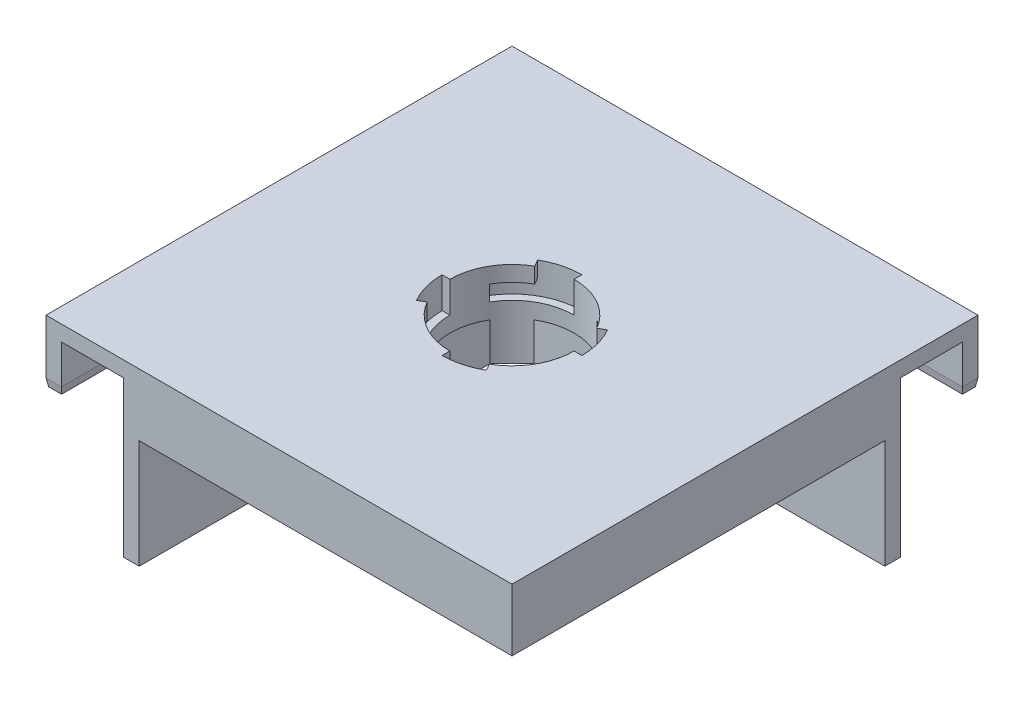
from build123d import *
from OCP.BRepFilletAPI import BRepFilletAPI_MakeChamfer
from build123d.topology import SkipClean

# Parameters (mm, degrees)
SKETCH1_R                 = 12
SKETCH1_R_2               = 8
BOSS_EXTRUDE4_DEPTH       = 2
BOSS_EXTRUDE5_START       = 2
SKETCH1_9_R               = 12
SKETCH1_9_R_2             = 9
BOSS_EXTRUDE5_DEPTH       = 4
BOSS_EXTRUDE6_START       = 2
BOSS_EXTRUDE6_DEPTH       = 2
BOSS_EXTRUDE7_START       = 4
BOSS_EXTRUDE7_DEPTH       = 2
BOSS_EXTRUDE8_START       = 4
SKETCH1_12_W              = 60
SKETCH1_12_H              = 60
SKETCH1_12_R              = 12
BOSS_EXTRUDE8_DEPTH       = 2
BOSS_EXTRUDE9_DEPTH       = 6
CHAMFER1_SIZE             = 1
CHAMFER1_SIZE2            = 0.176326981
BOSS_EXTRUDE10_DEPTH      = 6
BOSS_EXTRUDE11_DEPTH      = 20
BOSS_EXTRUDE12_DEPTH      = 2
BOSS_EXTRUDE12_DEPTH_BACK = 2
SKETCH1_14_R              = 8
CUT_EXTRUDE1_DEPTH        = 46.343136195


with BuildPart() as part:
    # Sketch1 → Boss-Extrude4 (new body)
    with BuildSketch(Plane(origin=(0, 0, 0), x_dir=(1, 0, 0), z_dir=(0, 1, 0))):
        with Locations(Location((0, 0, 0), (0, 0, 270))):
            Circle(SKETCH1_R)
        with Locations(Location((0, 0, 0), (0, 0, 270))):
            Circle(SKETCH1_R_2, mode=Mode.SUBTRACT)
    extrude(amount=BOSS_EXTRUDE4_DEPTH)

    # Sketch1<9> → Boss-Extrude5 (add)
    with BuildSketch(Plane(origin=(0, 0, 0), x_dir=(1, 0, 0), z_dir=(0, 1, 0)).offset(BOSS_EXTRUDE5_START)):
        with Locations(Location((0, 0, 0), (0, 0, 270))):
            Circle(SKETCH1_9_R)
        with Locations(Location((0, 0, 0), (0, 0, 270))):
            Circle(SKETCH1_9_R_2, mode=Mode.SUBTRACT)
    extrude(amount=BOSS_EXTRUDE5_DEPTH)

    # Sketch1<10> → Boss-Extrude6 (add)
    with SkipClean():  # the faces are left unmerged after this step: merging them gives an invalid solid
        with BuildSketch(Plane(origin=(0, 0, 0), x_dir=(1, 0, 0), z_dir=(0, 1, 0)).offset(BOSS_EXTRUDE6_START)):
            with BuildLine():
                ThreePointArc((0, 8), (2.070552361, 7.72740661), (4, 6.92820323))
                Line((4, 6.92820323), (4.5, 7.794228634))
                ThreePointArc((4.5, 7.794228634), (2.329371406, 8.693332437), (0, 9))
                Line((0, 9), (0, 8))
            make_face()
            with BuildLine():
                ThreePointArc((-8, 0), (-7.72740661, 2.070552361), (-6.92820323, 4))
                Line((-6.92820323, 4), (-7.794228634, 4.5))
                ThreePointArc((-7.794228634, 4.5), (-8.693332437, 2.329371406), (-9, 0))
                Line((-9, 0), (-8, 0))
            make_face()
            with BuildLine():
                Line((0, -9), (0, -8))
                ThreePointArc((0, -8), (-2.070552361, -7.72740661), (-4, -6.92820323))
                Line((-4, -6.92820323), (-4.5, -7.794228634))
                ThreePointArc((-4.5, -7.794228634), (-2.329371406, -8.693332437), (0, -9))
            make_face()
            with BuildLine():
                Line((9, 0), (8, 0))
                ThreePointArc((8, 0), (7.72740661, -2.070552361), (6.92820323, -4))
                Line((6.92820323, -4), (7.794228634, -4.5))
                ThreePointArc((7.794228634, -4.5), (8.693332437, -2.329371406), (9, 0))
            make_face()
        extrude(amount=BOSS_EXTRUDE6_DEPTH)

    # Sketch1<11> → Boss-Extrude7 (add)
    with SkipClean():  # the faces are left unmerged after this step: merging them gives an invalid solid
        with BuildSketch(Plane(origin=(0, 0, 0), x_dir=(1, 0, 0), z_dir=(0, 1, 0)).offset(BOSS_EXTRUDE7_START)):
            with BuildLine():
                ThreePointArc((0, 8), (2.070552361, 7.72740661), (4, 6.92820323))
                Line((4, 6.92820323), (4.5, 7.794228634))
                ThreePointArc((4.5, 7.794228634), (2.329371406, 8.693332437), (0, 9))
                Line((0, 9), (0, 8))
            make_face()
            with BuildLine():
                ThreePointArc((4, 6.92820323), (5.656854249, 5.656854249), (6.92820323, 4))
                Line((6.92820323, 4), (7.794228634, 4.5))
                ThreePointArc((7.794228634, 4.5), (6.363961031, 6.363961031), (4.5, 7.794228634))
                Line((4.5, 7.794228634), (4, 6.92820323))
            make_face()
            with BuildLine():
                ThreePointArc((-8, 0), (-7.72740661, 2.070552361), (-6.92820323, 4))
                Line((-6.92820323, 4), (-7.794228634, 4.5))
                ThreePointArc((-7.794228634, 4.5), (-8.693332437, 2.329371406), (-9, 0))
                Line((-9, 0), (-8, 0))
            make_face()
            with BuildLine():
                ThreePointArc((-6.92820323, 4), (-5.656854249, 5.656854249), (-4, 6.92820323))
                Line((-4, 6.92820323), (-4.5, 7.794228634))
                ThreePointArc((-4.5, 7.794228634), (-6.363961031, 6.363961031), (-7.794228634, 4.5))
                Line((-7.794228634, 4.5), (-6.92820323, 4))
            make_face()
            with BuildLine():
                Line((-4.5, -7.794228634), (-4, -6.92820323))
                ThreePointArc((-4, -6.92820323), (-5.656854249, -5.656854249), (-6.92820323, -4))
                Line((-6.92820323, -4), (-7.794228634, -4.5))
                ThreePointArc((-7.794228634, -4.5), (-6.363961031, -6.363961031), (-4.5, -7.794228634))
            make_face()
            with BuildLine():
                Line((0, -9), (0, -8))
                ThreePointArc((0, -8), (-2.070552361, -7.72740661), (-4, -6.92820323))
                Line((-4, -6.92820323), (-4.5, -7.794228634))
                ThreePointArc((-4.5, -7.794228634), (-2.329371406, -8.693332437), (0, -9))
            make_face()
            with BuildLine():
                Line((9, 0), (8, 0))
                ThreePointArc((8, 0), (7.72740661, -2.070552361), (6.92820323, -4))
                Line((6.92820323, -4), (7.794228634, -4.5))
                ThreePointArc((7.794228634, -4.5), (8.693332437, -2.329371406), (9, 0))
            make_face()
            with BuildLine():
                Line((7.794228634, -4.5), (6.92820323, -4))
                ThreePointArc((6.92820323, -4), (5.656854249, -5.656854249), (4, -6.92820323))
                Line((4, -6.92820323), (4.5, -7.794228634))
                ThreePointArc((4.5, -7.794228634), (6.363961031, -6.363961031), (7.794228634, -4.5))
            make_face()
        extrude(amount=BOSS_EXTRUDE7_DEPTH)

    # Sketch1<12> → Boss-Extrude8 (add)
    with SkipClean():  # the faces are left unmerged after this step: merging them gives an invalid solid
        with BuildSketch(Plane(origin=(0, 0, 0), x_dir=(1, 0, 0), z_dir=(0, 1, 0)).offset(BOSS_EXTRUDE8_START)):
            Rectangle(SKETCH1_12_W, SKETCH1_12_H)
            with Locations(Location((0, 0, 0), (0, 0, 270))):
                Circle(SKETCH1_12_R, mode=Mode.SUBTRACT)
        extrude(amount=BOSS_EXTRUDE8_DEPTH)

    # Sketch3 → Boss-Extrude9 (add)
    with SkipClean():  # the faces are left unmerged after this step: merging them gives an invalid solid
        with BuildSketch(Plane.XZ.offset(-4)):
            Polygon((-30, -30), (30, -30), (30, -28), (-28, -28), (-28, 30), (-30, 30), align=None)
            Polygon((30, -20), (30, -18), (-18, -18), (-18, 30), (-20, 30), (-20, -20), align=None)
        extrude(amount=BOSS_EXTRUDE9_DEPTH)

    # Chamfer1: one chamfer whose edges measure the first distance from different faces: ONE call of the kernel's chamfer builder (chamfer() names one face for all edges)
    chamfer1_edges_1 = [part.edges().sort_by_distance(p)[0] for p in [
        (-28, -2, 1),
    ]]
    chamfer1_side_1 = [part.faces().sort_by_distance(p)[0] for p in [
        (-28, 1, 1),
    ]]
    chamfer1_edges_2 = [part.edges().sort_by_distance(p)[0] for p in [
        (1, -2, -28),
    ]]
    chamfer1_side_2 = [part.faces().sort_by_distance(p)[0] for p in [
        (1, 1, -28),
    ]]
    chamfer1_edges_3 = [part.edges().sort_by_distance(p)[0] for p in [
        (-29, -2, 30),
    ]]
    chamfer1_side_3 = [part.faces().sort_by_distance(p)[0] for p in [
        (-29, 1, 30),
    ]]
    chamfer1_edges_4 = [part.edges().sort_by_distance(p)[0] for p in [
        (-30, -2, 0),
    ]]
    chamfer1_side_4 = [part.faces().sort_by_distance(p)[0] for p in [
        (-30, 1, 0),
    ]]
    chamfer1_edges_5 = [part.edges().sort_by_distance(p)[0] for p in [
        (0, -2, -30),
    ]]
    chamfer1_side_5 = [part.faces().sort_by_distance(p)[0] for p in [
        (0, 1, -30),
    ]]
    chamfer1_edges_6 = [part.edges().sort_by_distance(p)[0] for p in [
        (30, -2, -29),
    ]]
    chamfer1_side_6 = [part.faces().sort_by_distance(p)[0] for p in [
        (30, 1, -29),
    ]]
    chamfer1 = BRepFilletAPI_MakeChamfer(part.part.solid().wrapped)
    for e in chamfer1_edges_1:
        chamfer1.Add(CHAMFER1_SIZE, CHAMFER1_SIZE2, e.wrapped, chamfer1_side_1[0].wrapped)  # the first distance lies on this face
    for e in chamfer1_edges_2:
        chamfer1.Add(CHAMFER1_SIZE, CHAMFER1_SIZE2, e.wrapped, chamfer1_side_2[0].wrapped)  # the first distance lies on this face
    for e in chamfer1_edges_3:
        chamfer1.Add(CHAMFER1_SIZE, CHAMFER1_SIZE2, e.wrapped, chamfer1_side_3[0].wrapped)  # the first distance lies on this face
    for e in chamfer1_edges_4:
        chamfer1.Add(CHAMFER1_SIZE, CHAMFER1_SIZE2, e.wrapped, chamfer1_side_4[0].wrapped)  # the first distance lies on this face
    for e in chamfer1_edges_5:
        chamfer1.Add(CHAMFER1_SIZE, CHAMFER1_SIZE2, e.wrapped, chamfer1_side_5[0].wrapped)  # the first distance lies on this face
    for e in chamfer1_edges_6:
        chamfer1.Add(CHAMFER1_SIZE, CHAMFER1_SIZE2, e.wrapped, chamfer1_side_6[0].wrapped)  # the first distance lies on this face
    add(Compound.cast(chamfer1.Shape()), mode=Mode.REPLACE)

    # Sketch6 → Boss-Extrude10 (add)
    with BuildSketch(Plane.XZ.offset(-4)):
        Polygon((-18, 30), (-18, 28), (28, 28), (28, -18), (30, -18), (30, 30), align=None)
    extrude(amount=BOSS_EXTRUDE10_DEPTH)

    # Sketch3<3> → Boss-Extrude11 (add)
    with BuildSketch(Plane.XZ.offset(-4)):
        Polygon((-20, 30), (-20, -20), (-18, -18), (-18, 28), (-18, 30), align=None)
        Polygon((-20, -20), (30, -20), (30, -18), (28, -18), (-18, -18), align=None)
    extrude(amount=BOSS_EXTRUDE11_DEPTH)

    # Sketch9 → Boss-Extrude12 (add, two sides: drawn at the far end of the back side and taken through both)
    with BuildSketch(Plane(origin=(0, 0, 0), x_dir=(-0.7071067811865476, 0, -0.7071067811865475), z_dir=(0.7071067811865475, 0, -0.7071067811865476)).offset(-BOSS_EXTRUDE12_DEPTH_BACK)):
        Polygon((25.455844123, -16), (25.455844123, 0), (0, 0), align=None)
    extrude(amount=BOSS_EXTRUDE12_DEPTH + BOSS_EXTRUDE12_DEPTH_BACK)

    # Sketch1<14> → Cut-Extrude1 (cut, through all)
    with SkipClean():  # the faces are left unmerged after this step: merging them gives an invalid solid
        with BuildSketch(Plane(origin=(0, 0, 0), x_dir=(1, 0, 0), z_dir=(0, 1, 0))):
            with Locations(Location((0, 0, 0), (0, 0, 90))):
                Circle(SKETCH1_14_R)
        extrude(amount=-CUT_EXTRUDE1_DEPTH, mode=Mode.SUBTRACT)
    add(part.part.scale(1), mode=Mode.REPLACE)  # the faces are merged on a copy


solid = part.part
